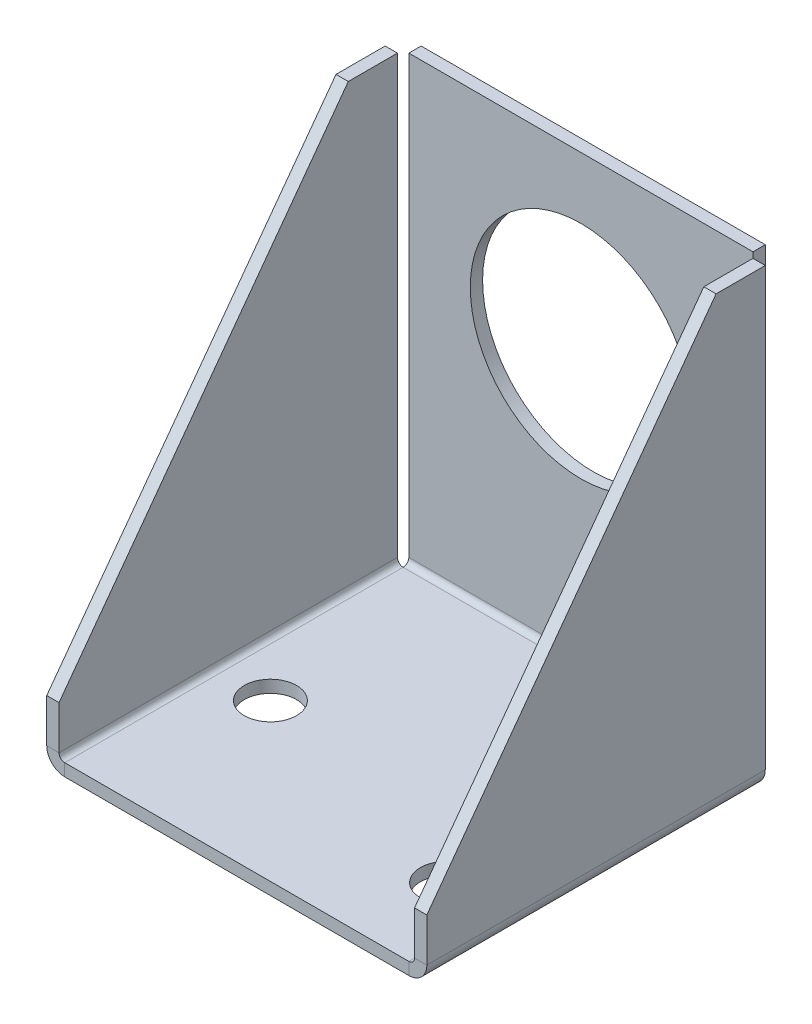
from build123d import *

# Parameters (mm, degrees)
BASE_FLANGE1_DEPTH        = 44.45
EDGE_FLANGE1_DEPTH        = 43.7134
EDGE_FLANGE1_START        = 1.5875
EDGE_FLANGE1_FLAT_DEPTH   = 1.5875
EDGE_FLANGE1_BEND_DEPTH   = 43.7134
EDGE_FLANGE1_FLAT_2_DEPTH = 1.5875
SKETCH12_R                = 14.2875
CUT_EXTRUDE1_DEPTH        = 88.025228164
SKETCH13_R                = 3.3782
CUT_EXTRUDE2_DEPTH        = 88.025228164


# Sheet-metal steps are written as plain solids
with BuildPart() as part:
    # Sketch1 → Base-Flange1 (new body)
    with BuildSketch(Plane(origin=(0, 0, 0), x_dir=(0, 0, -1), z_dir=(1, 0, 0))):
        with BuildLine():
            Line((0, 0), (43.7134, 0))
            ThreePointArc((43.7134, 0), (44.234254855, 0.215745145), (44.45, 0.7366))
            Line((44.45, 0.7366), (44.45, 57.15))
            Line((44.45, 57.15), (46.0375, 57.15))
            Line((46.0375, 57.15), (46.0375, 0.7366))
            ThreePointArc((46.0375, 0.7366), (45.35678687, -0.90678687), (43.7134, -1.5875))
            Line((43.7134, -1.5875), (0, -1.5875))
            Line((0, -1.5875), (0, 0))
        make_face()
    extrude(amount=BASE_FLANGE1_DEPTH)

    # Edge-Flange1 bend section (across the edge) → Edge-Flange1 (add)
    with BuildSketch(Plane(origin=(-0.7366, 0, -43.7134), x_dir=(1, 0, 0), z_dir=(0, 0, 1))):
        with BuildLine():
            Line((-1.5875, 0.7366), (0, 0.7366))
            ThreePointArc((0, 0.7366), (0.215745145, 0.215745145), (0.7366, 0))
            Line((0.7366, 0), (0.7366, -1.5875))
            ThreePointArc((0.7366, -1.5875), (-0.90678687, -0.90678687), (-1.5875, 0.7366))
        make_face()
    extrude(amount=EDGE_FLANGE1_DEPTH)

    # Edge-Flange1 profile (on flange) → Edge-Flange1 flat (add)
    with BuildSketch(Plane.ZY.offset(0.7366).offset(EDGE_FLANGE1_START)):
        Polygon((0, 0.7366), (0, 6.35), (-37.3634, 57.15), (-43.7134, 57.15), (-43.7134, 0.7366), align=None)
    extrude(amount=-EDGE_FLANGE1_FLAT_DEPTH)

    # Edge-Flange1 bend section 2 (across the edge) → Edge-Flange1 bend (add)
    with BuildSketch(Plane(origin=(45.1866, 0, 0), x_dir=(-1, 0, 0), z_dir=(0, 0, -1))):
        with BuildLine():
            Line((-1.5875, 0.7366), (0, 0.7366))
            ThreePointArc((0, 0.7366), (0.215745145, 0.215745145), (0.7366, 0))
            Line((0.7366, 0), (0.7366, -1.5875))
            ThreePointArc((0.7366, -1.5875), (-0.90678687, -0.90678687), (-1.5875, 0.7366))
        make_face()
    extrude(amount=EDGE_FLANGE1_BEND_DEPTH)

    # Edge-Flange1 profile 2 (on flange) → Edge-Flange1 flat 2 (add)
    with BuildSketch(Plane(origin=(45.1866, 0, 0), x_dir=(0, 0, -1), z_dir=(1, 0, 0)).offset(EDGE_FLANGE1_START)):
        Polygon((0, 6.35), (0, 0.7366), (43.7134, 0.7366), (43.7134, 57.15), (37.3634, 57.15), align=None)
    extrude(amount=-EDGE_FLANGE1_FLAT_2_DEPTH)

    # Sketch12 → Cut-Extrude1 (cut, through all)
    with BuildSketch(Plane(origin=(0, 0, -46.0375), x_dir=(-1, 0, 0), z_dir=(0, 0, -1))):
        with Locations((-22.225, 34.925)):
            Circle(SKETCH12_R)
    extrude(amount=-CUT_EXTRUDE1_DEPTH, mode=Mode.SUBTRACT)

    # Sketch13 → Cut-Extrude2 (cut, through all)
    with BuildSketch(Plane(origin=(0, 0, 0), x_dir=(1, 0, 0), z_dir=(0, 1, 0))):
        with Locations(Location((38.0844298, 11.2395, 0), (0, 0, 270))):
            Circle(SKETCH13_R)
        with Locations(Location((6.3344298, 20.235970884, 0), (0, 0, 270))):
            Circle(SKETCH13_R)
    extrude(amount=-CUT_EXTRUDE2_DEPTH, mode=Mode.SUBTRACT)


solid = part.part
